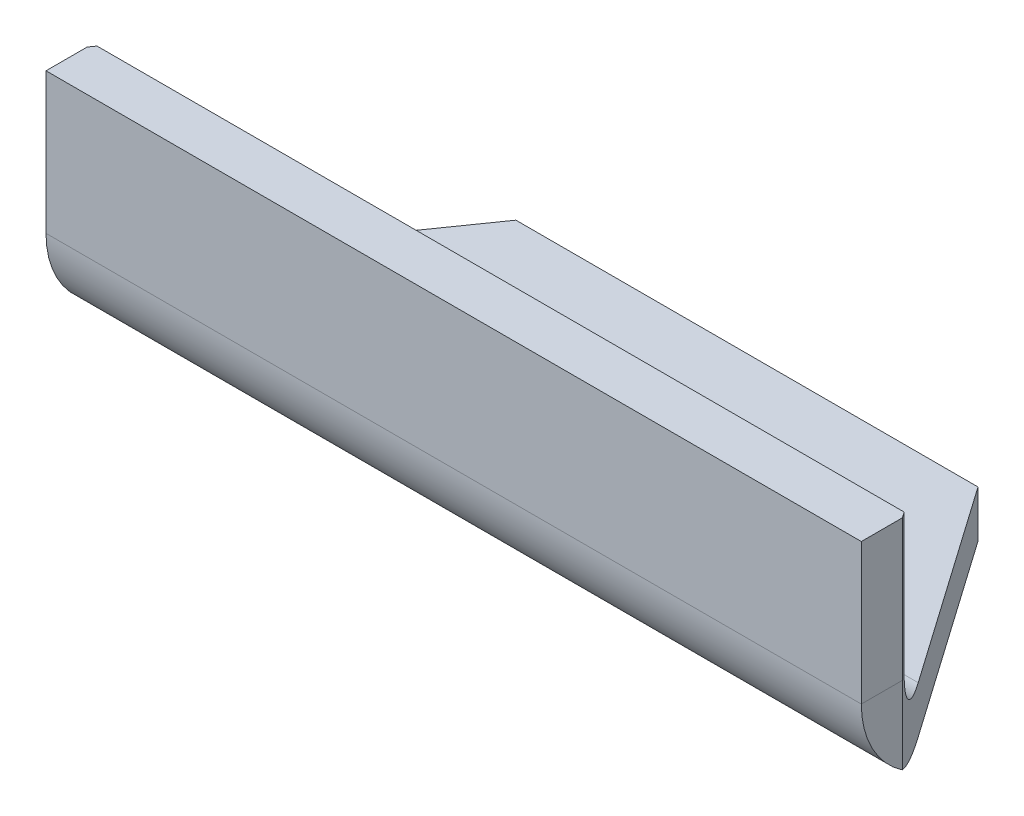
from build123d import *

# Parameters (mm, degrees)
SKETCH1_W                    = 139
SKETCH1_H                    = 50
BASE_FLANGE1_DEPTH           = 8
EDGE_FLANGE1_STRIP_W         = 48
EDGE_FLANGE1_STRIP_H         = 8
EDGE_FLANGE1_STRIP_CUT_DEPTH = 139
EDGE_FLANGE1_DEPTH           = 139
CHAMFER1_SIZE                = 43
CHAMFER1_SIZE2               = 30.108924143
MIRROR3_START                = 46.606691224
MIRROR3_OUTLINE_W            = 55
MIRROR3_OUTLINE_H            = 41
MIRROR3_DEPTH                = 24.663786763


# Read off the part's stored shape, not the designer's step: Mirror3
# Sheet-metal steps are written as plain solids
with BuildPart() as part:
    # Sketch1 → Base-Flange1 (new body)
    with BuildSketch(Plane(origin=(0, 0, 0), x_dir=(1, 0, 0), z_dir=(0, 1, 0))):
        Rectangle(SKETCH1_W, SKETCH1_H)
    extrude(amount=-BASE_FLANGE1_DEPTH)

    # Edge-Flange1 strip (across the edge) → Edge-Flange1 strip cut (cut)
    with BuildSketch(Plane(origin=(-69.5, 0, 25), x_dir=(0, 0, -1), z_dir=(1, 0, 0))):
        with Locations((-8, -4)):
            Rectangle(EDGE_FLANGE1_STRIP_W, EDGE_FLANGE1_STRIP_H)
    extrude(amount=EDGE_FLANGE1_STRIP_CUT_DEPTH, mode=Mode.SUBTRACT)

    # Edge-Flange1 section (across the edge) → Edge-Flange1 (add)
    with BuildSketch(Plane(origin=(-69.5, 0, 25), x_dir=(0, 0, -1), z_dir=(1, 0, 0))):
        with BuildLine():
            Line((0, 8), (0, 32))
            Line((0, 32), (8, 32))
            Line((8, 32), (8, 8))
            ThreePointArc((8, 8), (10.343145751, 2.343145751), (16, 0))
            Line((16, 0), (16, -8))
            ThreePointArc((16, -8), (4.686291501, -3.313708499), (0, 8))
        make_face()
    extrude(amount=EDGE_FLANGE1_DEPTH)

    # Chamfer1
    chamfer1_edges = [part.edges().sort_by_distance(p)[0] for p in [
        (-69.5, -4, -25),
    ]]
    chamfer1_side = [part.faces().sort_by_distance(p)[0] for p in [
        (-69.5, -0.640312424, -8),
    ]]
    chamfer(chamfer1_edges, length=CHAMFER1_SIZE, length2=CHAMFER1_SIZE2, reference=chamfer1_side[0])

    # Mirror3 outline → Mirror3 (cut)
    with BuildSketch(Plane(origin=(0, 0, 0), x_dir=(0.5735764363510512, 0, 0.8191520442889882), z_dir=(0.8191520442889882, 0, -0.5735764363510512)).offset(MIRROR3_START)):
        with Locations((28.5, -12.5)):
            Rectangle(MIRROR3_OUTLINE_W, MIRROR3_OUTLINE_H)
    extrude(amount=MIRROR3_DEPTH, mode=Mode.SUBTRACT)


solid = part.part
